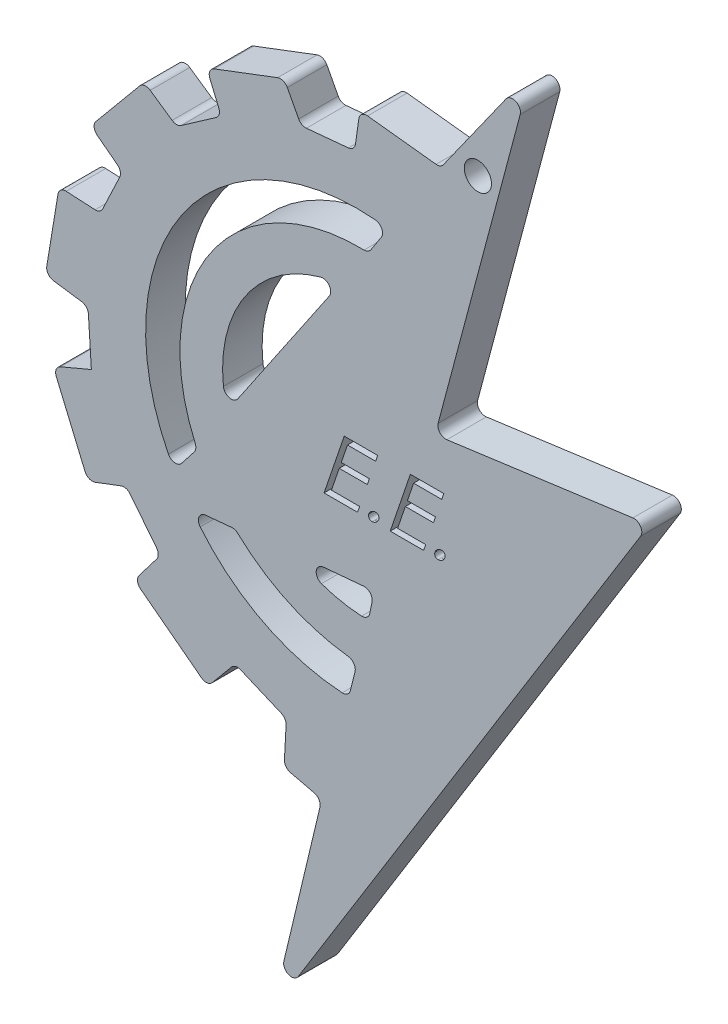
from build123d import *

# Parameters (mm, degrees)
RESSALTO_EXTRUS_O1_DEPTH = 10
FILETE1_R                = 2
ESBO_O4_R                = 3.444332471
CORTE_EXTRUS_O1_DEPTH    = 10
FILETE2_R                = 2
FILETE3_R                = 2
CORTE_EXTRUS_O2_DEPTH    = 4


with BuildPart() as part:
    # Esboço2 → Ressalto-extrusão1 (new body)
    with BuildSketch(Plane.XY):
        Polygon((193.773103164, 319.916047368), (169.387777077, 228.276709795), (223.624841469, 235.65805544), (128.263022007, 81.779967563), (140.73501024, 134.084502237), (131.191449506, 136.360159174), (131.772188371, 147.265122632), (118.817521468, 152.763324283), (111.812963201, 144.32772723), (93.305664051, 158.432339553), (99.89121501, 167.073538538), (91.322241313, 177.885139482), (81.590722241, 174.190482283), (72.773481605, 195.002691668), (82.438676772, 199.097420392), (81.590722241, 212.513154509), (70.824521896, 214.049684465), (74.27942347, 235.058686483), (84.728953772, 234.502201503), (90.303753207, 246.290652097), (82.265702337, 252.416537372), (95.826568645, 268.747903247), (104.008322567, 263.118742016), (115.315242335, 271.008080129), (111.599536693, 279.778629445), (131.191449506, 287.21687225), (135.511355665, 279.041334959), (149.026230144, 280.30655725), (150.383326776, 289.815499254), (170.809880345, 287.525305455), align=None)
        with BuildLine():
            Line((157.535851818, 267.435851282), (152.519260766, 259.721261682))
            ThreePointArc((152.519260766, 259.721261682), (112.509962952, 239.64411628), (109.196522494, 195.002691668))
            Line((109.196522494, 195.002691668), (103.416819477, 187.568977172))
            ThreePointArc((103.416819477, 187.568977172), (105.382075621, 244.506673941), (157.535851818, 267.435851282))
        make_face(mode=Mode.SUBTRACT)
        with BuildLine():
            Line((145.361197294, 249.311871047), (116.763511813, 207.182114897))
            ThreePointArc((116.763511813, 207.182114897), (121.453458378, 234.769513294), (145.361197294, 249.311871047))
        make_face(mode=Mode.SUBTRACT)
        with BuildLine():
            Line((153.99955404, 186.316468446), (152.519260766, 179.222419484))
            ThreePointArc((152.519260766, 179.222419484), (142.86341469, 180.574474729), (133.947042308, 184.519309376))
            Line((133.947042308, 184.519309376), (153.99955404, 186.316468446))
        make_face(mode=Mode.SUBTRACT)
        with BuildLine():
            Line((149.702993611, 168.534052382), (147.567616315, 159.926606308))
            ThreePointArc((147.567616315, 159.926606308), (125.134057337, 165.915182338), (107.746354808, 181.303340513))
            Line((107.746354808, 181.303340513), (118.817521468, 182.343801027))
            ThreePointArc((118.817521468, 182.343801027), (133.028349633, 172.68376741), (149.702993611, 168.534052382))
        make_face(mode=Mode.SUBTRACT)
    extrude(amount=RESSALTO_EXTRUS_O1_DEPTH)

    # Filete1
    filete1_edges = [part.edges().sort_by_distance(p)[0] for p in [
        (128.263022007, 81.779967563, 5),
        (169.387777077, 228.276709795, 5),
        (223.624841469, 235.65805544, 5),
        (193.773103164, 319.916047368, 5),
    ]]
    fillet(filete1_edges, radius=FILETE1_R)

    # Esboço4 → Corte-extrusão1 (cut)
    with BuildSketch(Plane.XY.offset(10)):
        with Locations((180.211688414, 290.388470621)):
            Circle(ESBO_O4_R)
    extrude(amount=-CORTE_EXTRUS_O1_DEPTH, mode=Mode.SUBTRACT)

    # Filete2
    filete2_edges = [part.edges().sort_by_distance(p)[0] for p in [
        (147.567616315, 159.926606308, 5),
        (149.702993611, 168.534052382, 5),
        (118.817521468, 182.343801027, 5),
        (107.746354808, 181.303340513, 5),
        (133.947042308, 184.519309376, 5),
        (153.99955404, 186.316468446, 5),
        (152.519260766, 179.222419484, 5),
        (103.416819477, 187.568977172, 5),
        (109.196522494, 195.002691668, 5),
        (116.763511813, 207.182114897, 5),
        (145.361197294, 249.311871047, 5),
        (152.519260766, 259.721261682, 5),
        (157.535851818, 267.435851282, 5),
    ]]
    fillet(filete2_edges, radius=FILETE2_R)

    # Filete3
    filete3_edges = [part.edges().sort_by_distance(p)[0] for p in [
        (140.73501024, 134.084502237, 5),
        (131.191449506, 136.360159174, 5),
        (131.772188371, 147.265122632, 5),
        (118.817521468, 152.763324283, 5),
        (111.812963201, 144.32772723, 5),
        (93.305664051, 158.432339553, 5),
        (91.322241313, 177.885139482, 5),
        (81.590722241, 174.190482283, 5),
        (99.89121501, 167.073538538, 5),
        (72.773481605, 195.002691668, 5),
        (81.590722241, 212.513154509, 5),
        (70.824521896, 214.049684465, 5),
        (74.27942347, 235.058686483, 5),
        (84.728953772, 234.502201503, 5),
        (90.303753207, 246.290652097, 5),
        (82.265702337, 252.416537372, 5),
        (104.008322567, 263.118742016, 5),
        (95.826568645, 268.747903247, 5),
        (115.315242335, 271.008080129, 5),
        (111.599536693, 279.778629445, 5),
        (131.191449506, 287.21687225, 5),
        (135.511355665, 279.041334959, 5),
        (149.026230144, 280.30655725, 5),
        (150.383326776, 289.815499254, 5),
        (170.809880345, 287.525305455, 5),
    ]]
    fillet(filete3_edges, radius=FILETE3_R)

    # Esboço5 → Corte-extrusão2 (cut)
    with BuildSketch(Plane.XY.offset(10)):
        Polygon((146.407049382, 216.497646893), (154.868587843, 216.497646893), (154.345751305, 214.959185354), (147.230366689, 214.959185354), (145.661857074, 210.343800739), (152.777241689, 210.343800739), (152.254405151, 208.805339201), (145.139020535, 208.805339201), (143.176881112, 203.036108431), (150.292265728, 203.036108431), (149.769429189, 201.497646893), (141.307890728, 201.497646893), align=None)
        with BuildLine():
            add(Edge.make_bspline(
                [(154.303683997, 203.805339201), (154.384281388, 203.800731206), (154.537479854, 203.79197239), (154.752796229, 203.725589769), (154.933096448, 203.607992591), (155.071597831, 203.445273656), (155.169769082, 203.252906505), (155.210966249, 203.034029017), (155.201695951, 202.796369916), (155.154812525, 202.63874164), (155.130006112, 202.555339201)],
                knots=[0, 0, 0, 0, 1.073913422, 2.041280588, 2.967472162, 3.904865179, 4.860635579, 5.814163262, 6.843455489, 8, 8, 8, 8], degree=3))
            add(Edge.make_bspline(
                [(155.130006112, 202.555339201), (155.096212975, 202.472161608), (155.028180892, 202.304709119), (154.882694973, 202.069152048), (154.687933222, 201.860191858), (154.468699868, 201.667210449), (154.22467682, 201.508956085), (153.971400198, 201.394268807), (153.713904647, 201.319734047), (153.539942934, 201.310124175), (153.45332342, 201.305339201)],
                knots=[0, 0, 0, 0, 0.972085847, 1.956995726, 2.979240181, 4.05653743, 5.116357727, 6.117110722, 7.062466382, 8, 8, 8, 8], degree=3))
            add(Edge.make_bspline(
                [(153.45332342, 201.305339201), (153.372658082, 201.30965985), (153.21901942, 201.317889143), (153.005109088, 201.38795773), (152.82690154, 201.506692833), (152.686791075, 201.668096037), (152.594713487, 201.863991781), (152.55160718, 202.082479179), (152.561556647, 202.318109158), (152.60650797, 202.473900064), (152.630006112, 202.555339201)],
                knots=[0, 0, 0, 0, 1.077955767, 2.053120761, 2.971613111, 3.912534593, 4.878066261, 5.835183142, 6.868349755, 8, 8, 8, 8], degree=3))
            add(Edge.make_bspline(
                [(152.630006112, 202.555339201), (152.66324037, 202.640839817), (152.729665085, 202.811728368), (152.881253797, 203.045349972), (153.0706836, 203.257778006), (153.292563555, 203.446234697), (153.534657239, 203.603642476), (153.786648258, 203.72164627), (154.044783064, 203.789309825), (154.2181932, 203.800046195), (154.303683997, 203.805339201)],
                knots=[0, 0, 0, 0, 0.992200319, 1.983093, 2.998310731, 4.068743982, 5.128775837, 6.119846933, 7.073088875, 8, 8, 8, 8], degree=3))
        make_face()
        Polygon((163.137818612, 216.497646893), (171.599357074, 216.497646893), (171.076520535, 214.959185354), (163.96113592, 214.959185354), (162.392626305, 210.343800739), (169.50801092, 210.343800739), (168.985174382, 208.805339201), (161.869789766, 208.805339201), (159.907650343, 203.036108431), (167.023034958, 203.036108431), (166.50019842, 201.497646893), (158.038659958, 201.497646893), align=None)
        with BuildLine():
            add(Edge.make_bspline(
                [(171.034453228, 203.805339201), (171.115050618, 203.800731206), (171.268249084, 203.79197239), (171.48356546, 203.725589769), (171.663865679, 203.607992591), (171.802367062, 203.445273656), (171.900538312, 203.252906505), (171.94173548, 203.034029017), (171.932465182, 202.796369916), (171.885581756, 202.63874164), (171.860775343, 202.555339201)],
                knots=[0, 0, 0, 0, 1.073913422, 2.041280588, 2.967472162, 3.904865179, 4.860635579, 5.814163262, 6.843455489, 8, 8, 8, 8], degree=3))
            add(Edge.make_bspline(
                [(171.860775343, 202.555339201), (171.826982206, 202.472161608), (171.758950122, 202.304709119), (171.613464203, 202.069152048), (171.418702453, 201.860191858), (171.199469099, 201.667210449), (170.955446051, 201.508956085), (170.702169428, 201.394268807), (170.444673878, 201.319734047), (170.270712165, 201.310124175), (170.184092651, 201.305339201)],
                knots=[0, 0, 0, 0, 0.972085847, 1.956995726, 2.979240181, 4.05653743, 5.116357727, 6.117110722, 7.062466382, 8, 8, 8, 8], degree=3))
            add(Edge.make_bspline(
                [(170.184092651, 201.305339201), (170.103427312, 201.30965985), (169.949788651, 201.317889143), (169.735878319, 201.38795773), (169.557670771, 201.506692833), (169.417560305, 201.668096037), (169.325482718, 201.863991781), (169.282376411, 202.082479179), (169.292325877, 202.318109158), (169.3372772, 202.473900064), (169.360775343, 202.555339201)],
                knots=[0, 0, 0, 0, 1.077955767, 2.053120761, 2.971613111, 3.912534593, 4.878066261, 5.835183142, 6.868349755, 8, 8, 8, 8], degree=3))
            add(Edge.make_bspline(
                [(169.360775343, 202.555339201), (169.394009601, 202.640839817), (169.460434316, 202.811728368), (169.612023028, 203.045349972), (169.80145283, 203.257778006), (170.023332785, 203.446234697), (170.265426469, 203.603642476), (170.517417489, 203.72164627), (170.775552295, 203.789309825), (170.948962431, 203.800046195), (171.034453228, 203.805339201)],
                knots=[0, 0, 0, 0, 0.992200319, 1.983093, 2.998310731, 4.068743982, 5.128775837, 6.119846933, 7.073088875, 8, 8, 8, 8], degree=3))
        make_face()
    extrude(amount=-CORTE_EXTRUS_O2_DEPTH, mode=Mode.SUBTRACT)


solid = part.part
